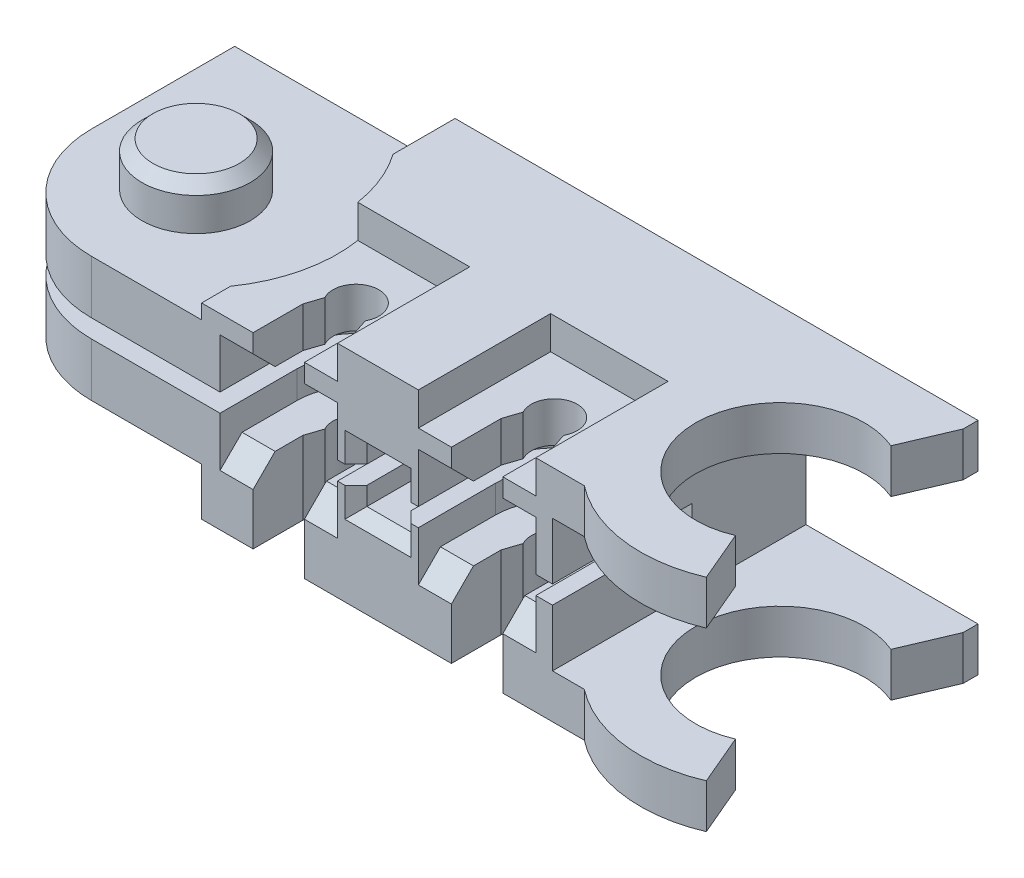
from build123d import *

# Parameters (mm, degrees)
BOSS_EXTRUDE7_DEPTH      = 20
SKETCH2_R                = 4.9175
BOSS_EXTRUDE2_DEPTH      = 4
CUT_EXTRUDE1_REACH       = 70.602
SKETCH3_R                = 7.665
SKETCH4_W                = 4
SKETCH4_H                = 5
CUT_EXTRUDE2_DEPTH       = 10
BOSS_EXTRUDE4_DEPTH      = 4
BOSS_EXTRUDE5_START      = -4
BOSS_EXTRUDE5_DEPTH      = 4
SKETCH25_R               = 12.83
SKETCH25_R_2             = 4.9175
CUT_EXTRUDE9_DEPTH       = 4.33
CUT_EXTRUDE10_START      = -4.33
CUT_EXTRUDE10_DEPTH      = 4.33
CUT_EXTRUDE5_DEPTH       = 70.42587576
SKETCH17_W               = 10.66
SKETCH17_H               = 6.66
CUT_EXTRUDE6_DEPTH       = 7
SKETCH18_W               = 3.2475
SKETCH18_H               = 6.66
SKETCH19_W               = 3.2475
SKETCH19_H               = 6.66
SKETCH20_W               = 51.84
SKETCH20_H               = 1.66
CUT_EXTRUDE7_DEPTH       = 12.66
CHAMFER2_SIZE            = 1
CHAMFER3_SIZE            = 1
CHAMFER4_SIZE            = 2
FILLET1_R                = 10
BOSS_EXTRUDE13_REACH     = 70.3
SKETCH23_W               = 10.34
SKETCH23_H               = 1.66
BOSS_EXTRUDE14_DEPTH     = 0.360269713
SKETCH24_W               = 12.33
SKETCH24_H               = 12
SKETCH24_W_2             = 10.66
CUT_EXTRUDE8_DEPTH       = 3
CHAMFER5_SIZE            = 1
CUT_EXTRUDE11_DEPTH      = 14
CUT_EXTRUDE11_DEPTH_BACK = 14
SKETCH27_R               = 2.0825
SKETCH28_R               = 2.0825
CUT_EXTRUDE12_DEPTH      = 14


with BuildPart() as part:
    # Sketch16 → Boss-Extrude7 (new body)
    with BuildSketch(Plane.XY):
        Polygon((-42.5, -10), (0, -10), (3, -10), (3, -6), (0, -6), (-10.66, -6), (-10.66, 6), (0, 6), (3, 6), (3, 10), (0, 10), (-42.5, 10), (-42.5, 5.67), (-53, 5.67), (-62.5, 5.67), (-62.5, -5.67), (-53, -5.67), (-42.5, -5.67), align=None)
    extrude(amount=BOSS_EXTRUDE7_DEPTH)

    # Sketch2 → Boss-Extrude2 (add)
    with BuildSketch(Plane.XZ.offset(5.67)):
        with Locations(Location((-53, 10, 0), (0, 0, 180))):
            Circle(SKETCH2_R)
    boss_extrude2 = extrude(amount=BOSS_EXTRUDE2_DEPTH)

    # Cut-Extrude1: up to this face of the body (flat: up to its plane)
    cut_extrude1_end = Plane(part.part.faces().sort_by_distance((-19.75, 10, 10))[0])
    # Sketch3 → Cut-Extrude1 (cut, up to the picked face)
    with BuildSketch(Plane.XZ.offset(10), mode=Mode.PRIVATE) as cut_extrude1_sk1:
        with Locations((0, 10)):
            Circle(SKETCH3_R)
    cut_extrude1_tool1 = split(extrude(cut_extrude1_sk1.sketch, amount=-CUT_EXTRUDE1_REACH, mode=Mode.PRIVATE), bisect_by=cut_extrude1_end, keep=Keep.BOTH, mode=Mode.PRIVATE)
    add(cut_extrude1_tool1.solids().sort_by(Axis((0, -10, 10), (0, 1, 0)))[0], mode=Mode.SUBTRACT)

    # Mirror1: Boss-Extrude2 across plane
    add(boss_extrude2.mirror(Plane.ZX))

    # Sketch4 → Cut-Extrude2 (cut)
    with BuildSketch(Plane.XY.offset(20)):
        with Locations((-26.5, 0)):
            Rectangle(SKETCH4_W, SKETCH4_H)
    extrude(amount=-CUT_EXTRUDE2_DEPTH, mode=Mode.SUBTRACT)

    # Sketch10 → Boss-Extrude4 (add)
    with BuildSketch(Plane.XZ.offset(10)):
        with BuildLine():
            Line((3, 17.053525714), (4.956947162, 21.654651425))
            ThreePointArc((4.956947162, 21.654651425), (-12.665, 10), (4.956947162, -1.654651425))
            Line((4.956947162, -1.654651425), (3, 2.946474286))
            ThreePointArc((3, 2.946474286), (-7.665, 10), (3, 17.053525714))
        make_face()
    extrude(amount=-BOSS_EXTRUDE4_DEPTH)

    # Sketch11 → Boss-Extrude5 (add)
    with BuildSketch(Plane(origin=(0, 10, 0), x_dir=(1, 0, 0), z_dir=(0, 1, 0)).offset(BOSS_EXTRUDE5_START)):
        with BuildLine():
            Line((4.956947162, -21.654651425), (3, -17.053525714))
            ThreePointArc((3, -17.053525714), (-7.665, -10), (3, -2.946474286))
            Line((3, -2.946474286), (4.956947162, 1.654651425))
            ThreePointArc((4.956947162, 1.654651425), (-1.632617278, 2.559330628), (-7.771886837, 0))
            Line((-7.771886837, 0), (-10.66, 0))
            Line((-10.66, 0), (-10.66, -20))
            Line((-10.66, -20), (-7.771886837, -20))
            ThreePointArc((-7.771886837, -20), (-1.632617278, -22.559330628), (4.956947162, -21.654651425))
        make_face()
    extrude(amount=BOSS_EXTRUDE5_DEPTH)

    # Sketch25 → Cut-Extrude9 (cut)
    with BuildSketch(Plane.XZ.offset(10)):
        with Locations((-53, 10)):
            Circle(SKETCH25_R)
        with Locations(Location((-53, 10, 0), (0, 0, 180))):
            Circle(SKETCH25_R_2, mode=Mode.SUBTRACT)
    extrude(amount=-CUT_EXTRUDE9_DEPTH, mode=Mode.SUBTRACT)

    # Sketch26 → Cut-Extrude10 (cut)
    with BuildSketch(Plane(origin=(0, 10, 0), x_dir=(1, 0, 0), z_dir=(0, 1, 0)).offset(CUT_EXTRUDE10_START)):
        with BuildLine():
            Line((-42.5, -2.627151161), (-42.5, -17.372848839))
            ThreePointArc((-42.5, -17.372848839), (-40.17, -10), (-42.5, -2.627151161))
        make_face()
    extrude(amount=CUT_EXTRUDE10_DEPTH, mode=Mode.SUBTRACT)

    # Sketch13 → Cut-Extrude5 (cut, through all)
    with BuildSketch(Plane.XZ.offset(10)):
        with BuildLine():
            Line((-37.83, 15.484673169), (-37.83, 20))
            Line((-37.83, 20), (-33.17, 20))
            Line((-33.17, 20), (-33.17, 15.484673169))
            Line((-33.17, 15.484673169), (-33.665, 13.984673169))
            ThreePointArc((-33.665, 13.984673169), (-35.5, 10.9175), (-37.335, 13.984673169))
            Line((-37.335, 13.984673169), (-37.83, 15.484673169))
        make_face()
        with BuildLine():
            Line((-19.83, 15.484673169), (-19.83, 20))
            Line((-19.83, 20), (-15.17, 20))
            Line((-15.17, 20), (-15.17, 15.484673169))
            Line((-15.17, 15.484673169), (-15.665, 13.984673169))
            ThreePointArc((-15.665, 13.984673169), (-17.5, 10.9175), (-19.335, 13.984673169))
            Line((-19.335, 13.984673169), (-19.83, 15.484673169))
        make_face()
    extrude(amount=-CUT_EXTRUDE5_DEPTH, mode=Mode.SUBTRACT)

    # Sketch17 → Cut-Extrude6 (cut)
    with BuildSketch(Plane.XY.offset(20)):
        with Locations((-35.5, 0)):
            Rectangle(SKETCH17_W, SKETCH17_H)
        with Locations((-17.5, 0)):
            Rectangle(SKETCH17_W, SKETCH17_H)
    extrude(amount=-CUT_EXTRUDE6_DEPTH, mode=Mode.SUBTRACT)

    # Sketch18 → Cut-Revolve1 (revolve, cut)
    with BuildSketch(Plane.XY.offset(13)):
        with Locations((-39.20625, 0)):
            Rectangle(SKETCH18_W, SKETCH18_H)
    revolve(axis=Axis((-35.5, 10, 13), (0, -1, 0)), mode=Mode.SUBTRACT)

    # Sketch19 → Cut-Revolve2 (revolve, cut)
    with BuildSketch(Plane.XY.offset(13)):
        with Locations((-21.20625, 0)):
            Rectangle(SKETCH19_W, SKETCH19_H)
    revolve(axis=Axis((-17.5, 10, 13), (0, -1, 0)), mode=Mode.SUBTRACT)

    # Sketch20 → Cut-Extrude7 (cut)
    with BuildSketch(Plane.XY.offset(20)):
        with Locations((-36.58, 0)):
            Rectangle(SKETCH20_W, SKETCH20_H)
    extrude(amount=-CUT_EXTRUDE7_DEPTH, mode=Mode.SUBTRACT)

    # Chamfer2
    chamfer2_edges = [part.edges().sort_by_distance(p)[0] for p in [
        (-48.0825, -9.67, 10),
    ]]
    chamfer(chamfer2_edges, length=CHAMFER2_SIZE)

    # Chamfer3
    chamfer3_edges = [part.edges().sort_by_distance(p)[0] for p in [
        (-48.0825, 9.67, 10),
    ]]
    chamfer(chamfer3_edges, length=CHAMFER3_SIZE)

    # Chamfer4
    chamfer4_edges = [part.edges().sort_by_distance(p)[0] for p in [
        (-31.67, -3.33, 20),
        (-31.67, 3.33, 20),
        (-39.33, 3.33, 20),
        (-39.33, -3.33, 20),
        (-13.67, -3.33, 20),
        (-13.67, 3.33, 20),
        (-21.33, 3.33, 20),
        (-21.33, -3.33, 20),
    ]]
    chamfer(chamfer4_edges, length=CHAMFER4_SIZE)

    # Fillet1
    # the kernel refuses this fillet: 10 mm, written as the material it takes off along each edge
    with BuildSketch(Plane(origin=(-62.5, 30.67, 0), x_dir=(1, 0, 0), z_dir=(0, -1, 0))) as fillet1_piece_1:
        with BuildLine():
            CenterArc((FILLET1_R, FILLET1_R), FILLET1_R, 180, 90)
            Line((0, FILLET1_R), (0, 0))
            Line((0, 0), (FILLET1_R, 0))
        make_face()
    extrude(amount=61.34, mode=Mode.SUBTRACT)
    with BuildSketch(Plane(origin=(-62.5, 30.67, 20), x_dir=(1, 0, 0), z_dir=(0, -1, 0)), Plane(origin=(-62.5, 24.17, 20), x_dir=(1, 0, 0), z_dir=(0, -1, 0))) as fillet1_piece_2:
        with BuildLine():
            CenterArc((FILLET1_R, -FILLET1_R), FILLET1_R, 90, 90)
            Line((0, -FILLET1_R), (0, 0))
            Line((0, 0), (FILLET1_R, 0))
        make_face()
    extrude(amount=54.84, mode=Mode.SUBTRACT)

    # Sketch22 → Boss-Extrude13 (add, up to next)
    with BuildSketch(Plane(origin=(0, 0, -3), x_dir=(-1, 0, 0), z_dir=(0, 0, -1)), mode=Mode.PRIVATE) as boss_extrude13_sk1:
        Polygon((62.5, 5.67), (52.5, 5.67), (42.5, 5.67), (42.5, 10), (7.771886837, 10), (-4.956947162, 10), (-4.956947162, 6), (7.771886837, 6), (10.66, 6), (10.66, -6), (7.771886837, -6), (-4.956947162, -6), (-4.956947162, -10), (7.771886837, -10), (42.5, -10), (42.5, -5.67), (52.5, -5.67), (62.5, -5.67), (62.5, -0.83), (62.139730287, -0.83), (62.139730287, 0.83), (62.5, 0.83), align=None)
    boss_extrude13_tool1 = extrude(boss_extrude13_sk1.sketch, amount=-BOSS_EXTRUDE13_REACH, mode=Mode.PRIVATE) - part.part
    add(boss_extrude13_tool1.solids().sort_by_distance((-29.508071, 0, -3))[0])

    # Sketch23 → Boss-Extrude14 (add)
    with BuildSketch(Plane.ZY.offset(62.139730287)):
        with Locations((2.17, 0)):
            Rectangle(SKETCH23_W, SKETCH23_H)
    extrude(amount=BOSS_EXTRUDE14_DEPTH)

    # Sketch24 → Cut-Extrude8 (cut)
    with BuildSketch(Plane(origin=(0, 10, 0), x_dir=(1, 0, 0), z_dir=(0, 1, 0))):
        with Locations((-36.335, -14)):
            Rectangle(SKETCH24_W, SKETCH24_H)
        with Locations((-17.5, -14)):
            Rectangle(SKETCH24_W_2, SKETCH24_H)
    extrude(amount=-CUT_EXTRUDE8_DEPTH, mode=Mode.SUBTRACT)

    # Chamfer5
    chamfer5_edges = [part.edges().sort_by_distance(p)[0] for p in [
        (-24.5, 1.665, 20),
        (-28.5, -1.665, 20),
        (-26.5, -2.5, 20),
        (-24.5, -1.665, 20),
        (-26.5, 2.5, 20),
        (-28.5, 1.665, 20),
    ]]
    chamfer(chamfer5_edges, length=CHAMFER5_SIZE)

    # Sketch27 → Cut-Extrude11 (cut, two sides: drawn at the far end of the back side and taken through both)
    with BuildSketch(Plane(origin=(-16.214466094, 0, 16.214466094), x_dir=(0, 1, 0), z_dir=(0.7071067811865389, 0, -0.7071067811865561)).offset(-CUT_EXTRUDE11_DEPTH_BACK)):
        with Locations(Location((0, -29.255858544, 0), (0, 0, 270))):
            Circle(SKETCH27_R)
    extrude(amount=CUT_EXTRUDE11_DEPTH + CUT_EXTRUDE11_DEPTH_BACK, mode=Mode.SUBTRACT)

    # Sketch28 → Cut-Extrude12 (cut)
    with BuildSketch(Plane(origin=(-13.901067812, 0, -13.901067812), x_dir=(0, -1, 0), z_dir=(-0.7071067811865389, 0, -0.7071067811865561))):
        with Locations(Location((0, 13.333937944, 0), (0, 0, 90))):
            Circle(SKETCH28_R)
    extrude(amount=-CUT_EXTRUDE12_DEPTH, mode=Mode.SUBTRACT)


solid = part.part
